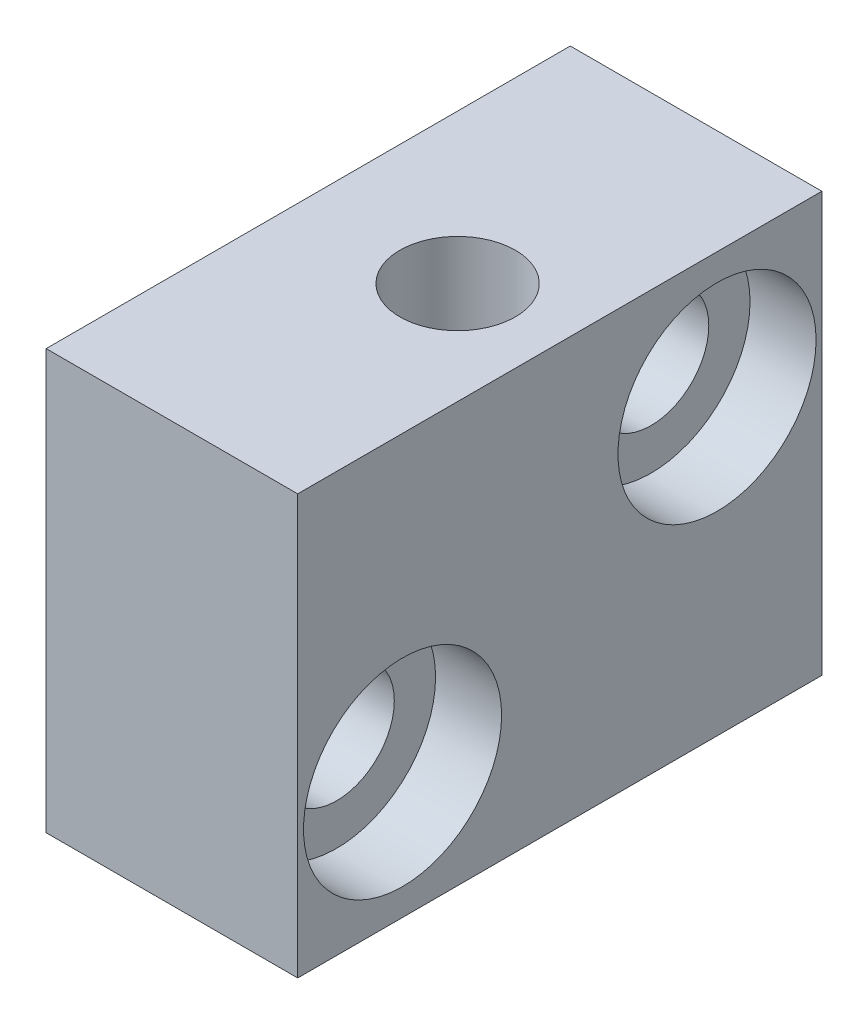
from build123d import *

# Parameters (mm, degrees)
SKETCH1_W           = 12.7
SKETCH1_H           = 15.875
BOSS_EXTRUDE1_DEPTH = 7.62
SKETCH3_R           = 1.75
CUT_EXTRUDE1_DEPTH  = 22.2885
SKETCH4_R           = 1.75
CUT_EXTRUDE2_DEPTH  = 22.2885
SKETCH5_R           = 3
CUT_EXTRUDE3_DEPTH  = 2


with BuildPart() as part:
    # Sketch1 → Boss-Extrude1 (new body)
    with BuildSketch(Plane.YZ):
        Rectangle(SKETCH1_W, SKETCH1_H)
    extrude(amount=BOSS_EXTRUDE1_DEPTH)

    # Sketch3 → Cut-Extrude1 (cut)
    with BuildSketch(Plane.XZ.offset(6.35)):
        with Locations((4.525, 0)):
            Circle(SKETCH3_R)
    extrude(amount=-CUT_EXTRUDE1_DEPTH, mode=Mode.SUBTRACT)

    # Sketch4 → Cut-Extrude2 (cut)
    with BuildSketch(Plane.YZ.offset(7.62)):
        with Locations((-2.54, 4.7625)):
            Circle(SKETCH4_R)
        with Locations((2.54, -4.7625)):
            Circle(SKETCH4_R)
    extrude(amount=-CUT_EXTRUDE2_DEPTH, mode=Mode.SUBTRACT)

    # Sketch5 → Cut-Extrude3 (cut)
    with BuildSketch(Plane.YZ.offset(7.62)):
        with Locations((-2.54, 4.7625)):
            Circle(SKETCH5_R)
        with Locations((2.54, -4.7625)):
            Circle(SKETCH5_R)
    extrude(amount=-CUT_EXTRUDE3_DEPTH, mode=Mode.SUBTRACT)


solid = part.part
